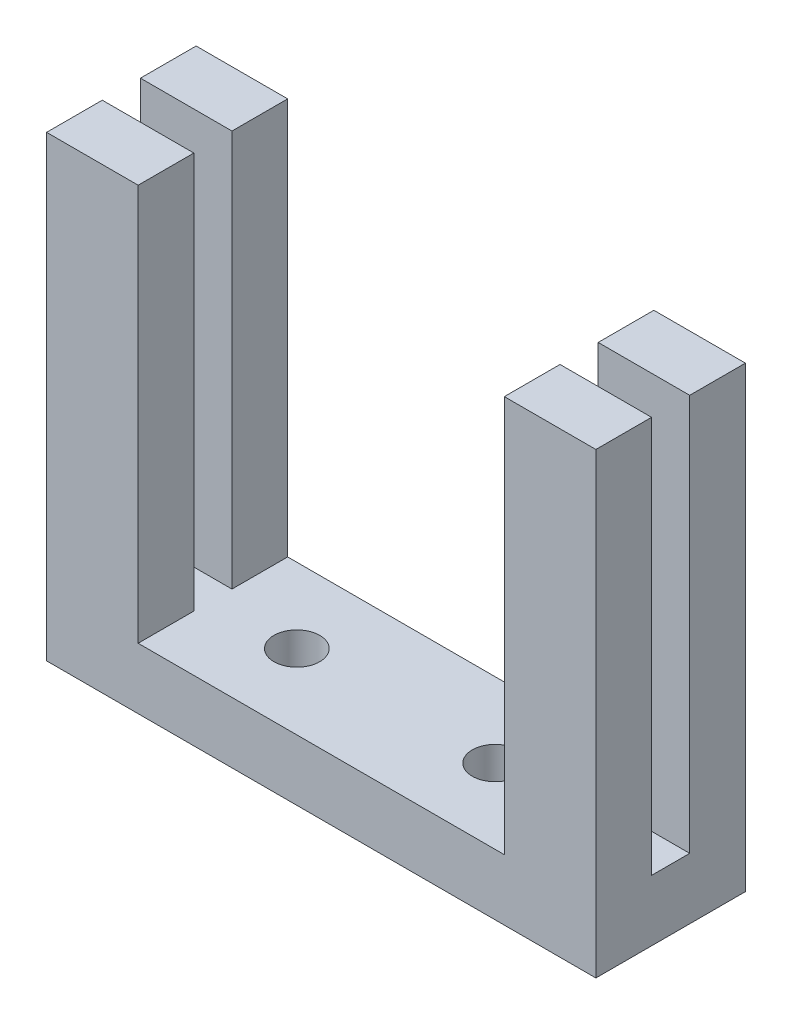
from build123d import *

# Parameters (mm, degrees)
SKETCH_1_W          = 36
SKETCH_1_H          = 9.8
EXTRUDE_1_DEPTH     = 30
SKETCH_2_W          = 2.5
SKETCH_2_H          = 26
CUT_EXTRUDE_1_DEPTH = 48.116982077
SKETCH_3_W          = 24
SKETCH_3_H          = 26
CUT_EXTRUDE_2_DEPTH = 37.332354727
SKETCH1_R           = 1.5
CUT_EXTRUDE2_DEPTH  = 33.00015625


with BuildPart() as part:
    # 草图1 → 凸台-拉伸1 (new body)
    with BuildSketch(Plane(origin=(0, 0, 0), x_dir=(1, 0, 0), z_dir=(0, 1, 0))):
        Rectangle(SKETCH_1_W, SKETCH_1_H)
    extrude(amount=EXTRUDE_1_DEPTH)

    # 草图2 → 切除-拉伸1 (cut, through all)
    with BuildSketch(Plane(origin=(18, 0, 0), x_dir=(0, 0, -1), z_dir=(1, 0, 0))):
        with Locations((0, 17)):
            Rectangle(SKETCH_2_W, SKETCH_2_H)
    extrude(amount=-CUT_EXTRUDE_1_DEPTH, mode=Mode.SUBTRACT)

    # 草图3 → 切除-拉伸2 (cut, through all)
    with BuildSketch(Plane(origin=(0, 0, -4.9), x_dir=(-1, 0, 0), z_dir=(0, 0, -1))):
        with Locations((0, 17)):
            Rectangle(SKETCH_3_W, SKETCH_3_H)
    extrude(amount=-CUT_EXTRUDE_2_DEPTH, mode=Mode.SUBTRACT)

    # Sketch1 → Cut-Extrude2 (cut, through all)
    with BuildSketch(Plane(origin=(0, 4, 0), x_dir=(1, 0, 0), z_dir=(0, 1, 0))):
        with Locations((-6.5, 0)):
            Circle(SKETCH1_R)
        with Locations((6.5, 0)):
            Circle(SKETCH1_R)
    extrude(amount=-CUT_EXTRUDE2_DEPTH, mode=Mode.SUBTRACT)


solid = part.part
